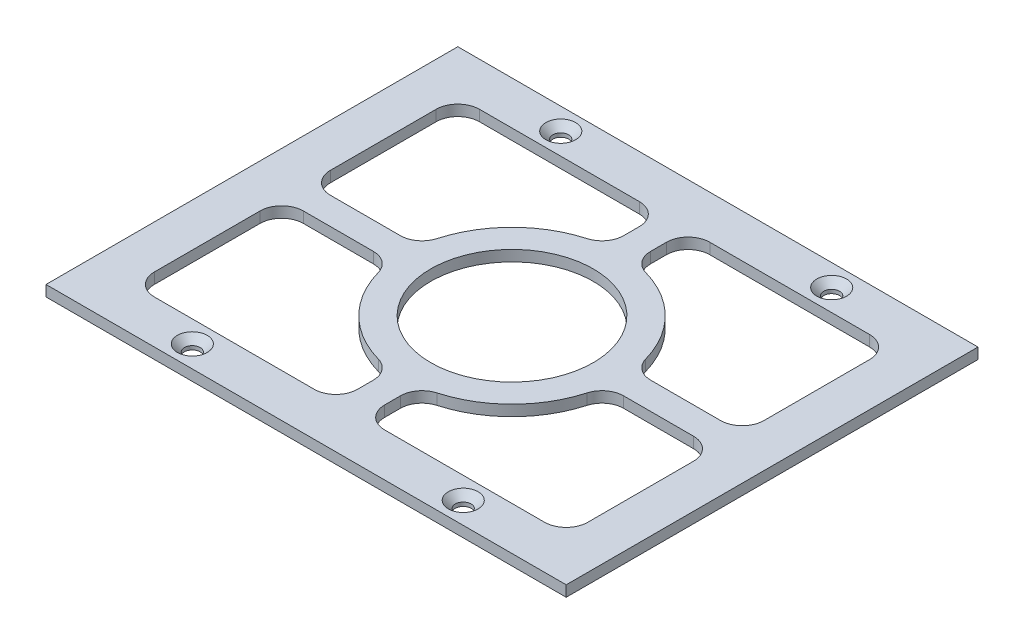
from build123d import *

# Parameters (mm, degrees)
SCHIZZO1_W                               = 96
SCHIZZO1_H                               = 76
ESTRUSIONE_ESTRUSIONE1_DEPTH             = 1
TAGLIO_ESTRUSIONE1_DEPTH                 = 62.253571324
TAGLIO_ESTRUSIONE1_DEPTH_BACK            = 62.253571324
SCHIZZO2_R                               = 15
TAGLIO_ESTRUSIONE2_DEPTH                 = 62.253571324
RACCORDO1_R                              = 4
SPECCHIA1_START                          = -1
SPECCHIA1_DEPTH                          = 2
FORO_SVASATO_PER_VITE_M2_5_1_D           = 2.9
FORO_SVASATO_PER_VITE_M2_5_1_DEPTH       = 8.25
FORO_SVASATO_PER_VITE_M2_5_1_CSINK_D     = 5.5
FORO_SVASATO_PER_VITE_M2_5_1_CSINK_ANGLE = 90
FORO_SVASATO_PER_VITE_M2_5_1_TIP         = 0.871247898


# Read off the part's stored shape, not the designer's step: Specchia1
with BuildPart() as part:
    # Schizzo1 → Estrusione-Estrusione1 (new, symmetric)
    with BuildSketch(Plane(origin=(0, 0, 0), x_dir=(1, 0, 0), z_dir=(0, 1, 0))):
        Rectangle(SCHIZZO1_W, SCHIZZO1_H)
    extrude(amount=ESTRUSIONE_ESTRUSIONE1_DEPTH, both=True)

    # Schizzo2 → Taglio-Estrusione1 (cut, two sides: drawn at the far end of the back side and taken through both)
    with BuildSketch(Plane(origin=(0, 1, 0), x_dir=(1, 0, 0), z_dir=(0, 1, 0)).offset(-TAGLIO_ESTRUSIONE1_DEPTH_BACK)):
        with Locations(Location((0, 0, 0), (0, 0, 270))):
            Circle(SCHIZZO2_R)
    extrude(amount=TAGLIO_ESTRUSIONE1_DEPTH + TAGLIO_ESTRUSIONE1_DEPTH_BACK, mode=Mode.SUBTRACT)

    # Schizzo3 → Taglio-Estrusione2 (cut, through all)
    with BuildSketch(Plane(origin=(0, 1, 0), x_dir=(1, 0, 0), z_dir=(0, 1, 0))):
        with BuildLine():
            Line((-2.5, 30), (-2.5, 19.843134833))
            ThreePointArc((-2.5, 19.843134833), (-14.142135624, 14.142135624), (-19.843134833, 2.5))
            Line((-19.843134833, 2.5), (-40, 2.5))
            Line((-40, 2.5), (-40, 30))
            Line((-40, 30), (-2.5, 30))
        make_face()
    extrude(amount=-TAGLIO_ESTRUSIONE2_DEPTH, mode=Mode.SUBTRACT)

    # Raccordo1
    raccordo1_edges = [part.edges().sort_by_distance(p)[0] for p in [
        (-40, 0, -2.5),
        (-40, 0, -30),
        (-2.5, 0, -30),
        (-2.5, 0, -19.843134833),
        (-19.843134833, 0, -2.5),
    ]]
    fillet(raccordo1_edges, radius=RACCORDO1_R)

    # Specchia1 outline → Specchia1 (cut)
    with BuildSketch(Plane(origin=(0, 0, 0), x_dir=(1, 0, 0), z_dir=(0, 1, 0)).offset(SPECCHIA1_START)):
        with BuildLine():
            Line((-40, -6.5), (-40, -26))
            ThreePointArc((-40, -26), (-38.828427125, -28.828427125), (-36, -30))
            Line((-36, -30), (-6.5, -30))
            ThreePointArc((-6.5, -30), (-3.671572875, -28.828427125), (-2.5, -26))
            Line((-2.5, -26), (-2.5, -23.103030104))
            ThreePointArc((-2.5, -23.103030104), (-3.311478922, -20.687800647), (-5.416666667, -19.252525087))
            ThreePointArc((-5.416666667, -19.252525087), (-14.142135624, -14.142135624), (-19.252525087, -5.416666667))
            ThreePointArc((-19.252525087, -5.416666667), (-20.687800647, -3.311478922), (-23.103030104, -2.5))
            Line((-23.103030104, -2.5), (-36, -2.5))
            ThreePointArc((-36, -2.5), (-38.828427125, -3.671572875), (-40, -6.5))
        make_face()
        with BuildLine():
            Line((36, 30), (6.5, 30))
            ThreePointArc((6.5, 30), (3.671572875, 28.828427125), (2.5, 26))
            Line((2.5, 26), (2.5, 23.103030104))
            ThreePointArc((2.5, 23.103030104), (3.311478922, 20.687800647), (5.416666667, 19.252525087))
            ThreePointArc((5.416666667, 19.252525087), (14.142135624, 14.142135624), (19.252525087, 5.416666667))
            ThreePointArc((19.252525087, 5.416666667), (20.687800647, 3.311478922), (23.103030104, 2.5))
            Line((23.103030104, 2.5), (36, 2.5))
            ThreePointArc((36, 2.5), (38.828427125, 3.671572875), (40, 6.5))
            Line((40, 6.5), (40, 26))
            ThreePointArc((40, 26), (38.828427125, 28.828427125), (36, 30))
        make_face()
        with BuildLine():
            ThreePointArc((19.252525087, -5.416666667), (14.142135624, -14.142135624), (5.416666667, -19.252525087))
            ThreePointArc((5.416666667, -19.252525087), (3.311478922, -20.687800647), (2.5, -23.103030104))
            Line((2.5, -23.103030104), (2.5, -26))
            ThreePointArc((2.5, -26), (3.671572875, -28.828427125), (6.5, -30))
            Line((6.5, -30), (36, -30))
            ThreePointArc((36, -30), (38.828427125, -28.828427125), (40, -26))
            Line((40, -26), (40, -6.5))
            ThreePointArc((40, -6.5), (38.828427125, -3.671572875), (36, -2.5))
            Line((36, -2.5), (23.103030104, -2.5))
            ThreePointArc((23.103030104, -2.5), (20.687800647, -3.311478922), (19.252525087, -5.416666667))
        make_face()
    extrude(amount=SPECCHIA1_DEPTH, mode=Mode.SUBTRACT)

    # Foro svasato per Vite M2.5-1
    with Locations(Plane(origin=(0, 1, 0), x_dir=(1, 0, 0), z_dir=(0, 1, 0))):
        with Locations((-25, 34), (25, 34), (25, -34), (-25, -34)):
            CounterSinkHole(FORO_SVASATO_PER_VITE_M2_5_1_D / 2, FORO_SVASATO_PER_VITE_M2_5_1_CSINK_D / 2, depth=FORO_SVASATO_PER_VITE_M2_5_1_DEPTH, counter_sink_angle=FORO_SVASATO_PER_VITE_M2_5_1_CSINK_ANGLE)
            with Locations((0, 0, -(FORO_SVASATO_PER_VITE_M2_5_1_DEPTH + FORO_SVASATO_PER_VITE_M2_5_1_TIP / 2))):  # 118° drill point
                Cone(0, FORO_SVASATO_PER_VITE_M2_5_1_D / 2, FORO_SVASATO_PER_VITE_M2_5_1_TIP, mode=Mode.SUBTRACT)


solid = part.part
